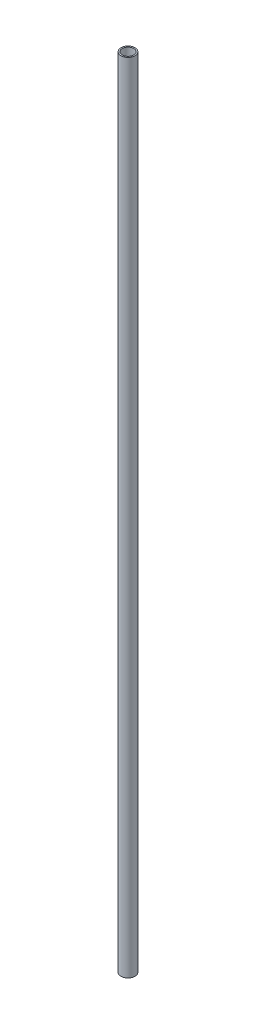
from build123d import *

# Parameters (mm, degrees)
SKETCH1_R           = 4.825
SKETCH1_R_2         = 3.925
BOSS_EXTRUDE1_DEPTH = 550


with BuildPart() as part:
    # Sketch1 → Boss-Extrude1 (new body)
    with BuildSketch(Plane(origin=(0, 0, 0), x_dir=(1, 0, 0), z_dir=(0, 1, 0))):
        Circle(SKETCH1_R)
        Circle(SKETCH1_R_2, mode=Mode.SUBTRACT)
    extrude(amount=BOSS_EXTRUDE1_DEPTH)


solid = part.part
